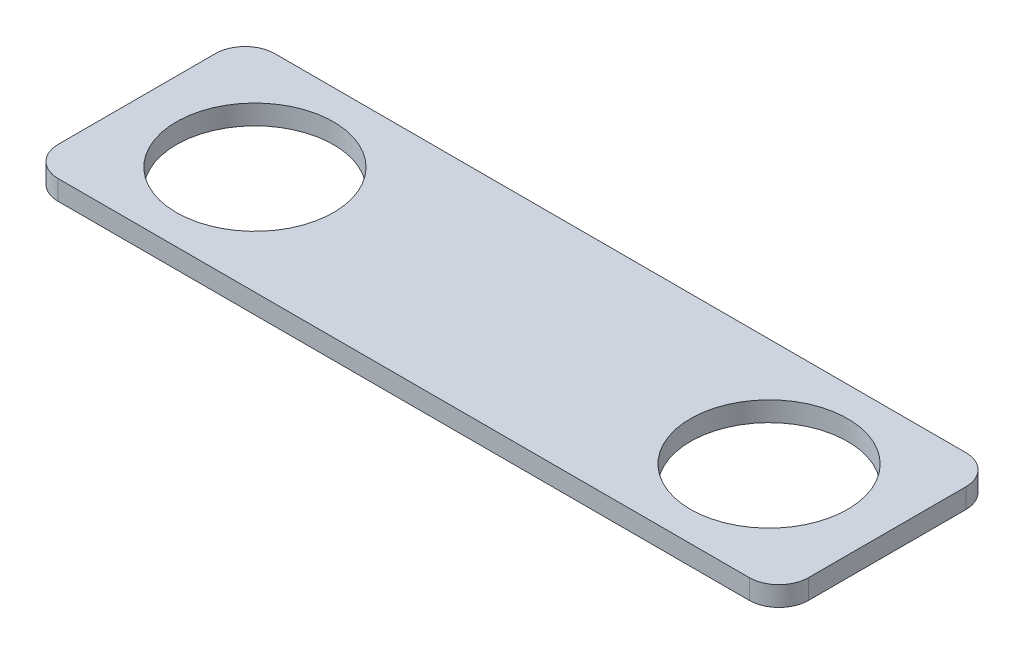
from build123d import *

# Parameters (mm, degrees)
SKETCH1_W           = 75.9
SKETCH1_H           = 21.9
SKETCH1_R           = 7.95
BOSS_EXTRUDE1_DEPTH = 2
FILLET1_R           = 3


with BuildPart() as part:
    # Sketch1 → Boss-Extrude1 (new body)
    with BuildSketch(Plane(origin=(0, 0, 0), x_dir=(1, 0, 0), z_dir=(0, 1, 0))):
        Rectangle(SKETCH1_W, SKETCH1_H)
        with Locations(Location((26, 0, 0), (0, 0, 270))):
            Circle(SKETCH1_R, mode=Mode.SUBTRACT)
        with Locations(Location((-26, 0, 0), (0, 0, 270))):
            Circle(SKETCH1_R, mode=Mode.SUBTRACT)
    extrude(amount=BOSS_EXTRUDE1_DEPTH)

    # Fillet1
    fillet1_edges = [part.edges().sort_by_distance(p)[0] for p in [
        (37.95, 1, -10.95),
        (37.95, 1, 10.95),
        (-37.95, 1, 10.95),
        (-37.95, 1, -10.95),
    ]]
    fillet(fillet1_edges, radius=FILLET1_R)


solid = part.part
